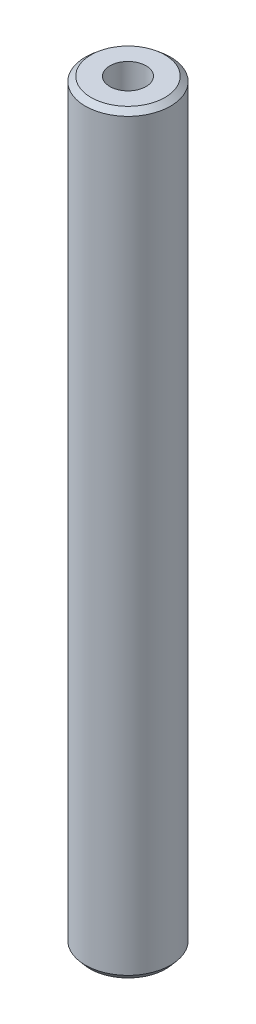
from build123d import *
from OCP.BRepFilletAPI import BRepFilletAPI_MakeChamfer

# Parameters (mm, degrees)
SKETCH1_R           = 5
BOSS_EXTRUDE1_DEPTH = 88.599224597
SKETCH2_R           = 2.121098075
CUT_EXTRUDE1_DEPTH  = 89.88094621
CHAMFER1_SIZE       = 0.553335042
CHAMFER1_SIZE2      = 0.660115917


with BuildPart() as part:
    # Sketch1 → Boss-Extrude1 (new body)
    with BuildSketch(Plane(origin=(0, 0, 0), x_dir=(1, 0, 0), z_dir=(0, 1, 0))):
        Circle(SKETCH1_R)
    extrude(amount=BOSS_EXTRUDE1_DEPTH)

    # Sketch2 → Cut-Extrude1 (cut, through all)
    with BuildSketch(Plane(origin=(0, 0, 0), x_dir=(1, 0, 0), z_dir=(0, 1, 0))):
        Circle(SKETCH2_R)
    extrude(amount=CUT_EXTRUDE1_DEPTH, mode=Mode.SUBTRACT)

    # Chamfer1: one chamfer whose edges measure the first distance from different faces: ONE call of the kernel's chamfer builder (chamfer() names one face for all edges)
    chamfer1_edges_1 = [part.edges().sort_by_distance(p)[0] for p in [
        (-5, 88.599224597, 0),
    ]]
    chamfer1_side_1 = [part.faces().sort_by_distance(p)[0] for p in [
        (-5, 44.299612298, 0),
    ]]
    chamfer1_edges_2 = [part.edges().sort_by_distance(p)[0] for p in [
        (-5, 0, 0),
    ]]
    chamfer1_side_2 = [part.faces().sort_by_distance(p)[0] for p in [
        (-4.858578644, 0, 0),
    ]]
    chamfer1 = BRepFilletAPI_MakeChamfer(part.part.solid().wrapped)
    for e in chamfer1_edges_1:
        chamfer1.Add(CHAMFER1_SIZE, CHAMFER1_SIZE2, e.wrapped, chamfer1_side_1[0].wrapped)  # the first distance lies on this face
    for e in chamfer1_edges_2:
        chamfer1.Add(CHAMFER1_SIZE, CHAMFER1_SIZE2, e.wrapped, chamfer1_side_2[0].wrapped)  # the first distance lies on this face
    add(Compound.cast(chamfer1.Shape()), mode=Mode.REPLACE)


solid = part.part
